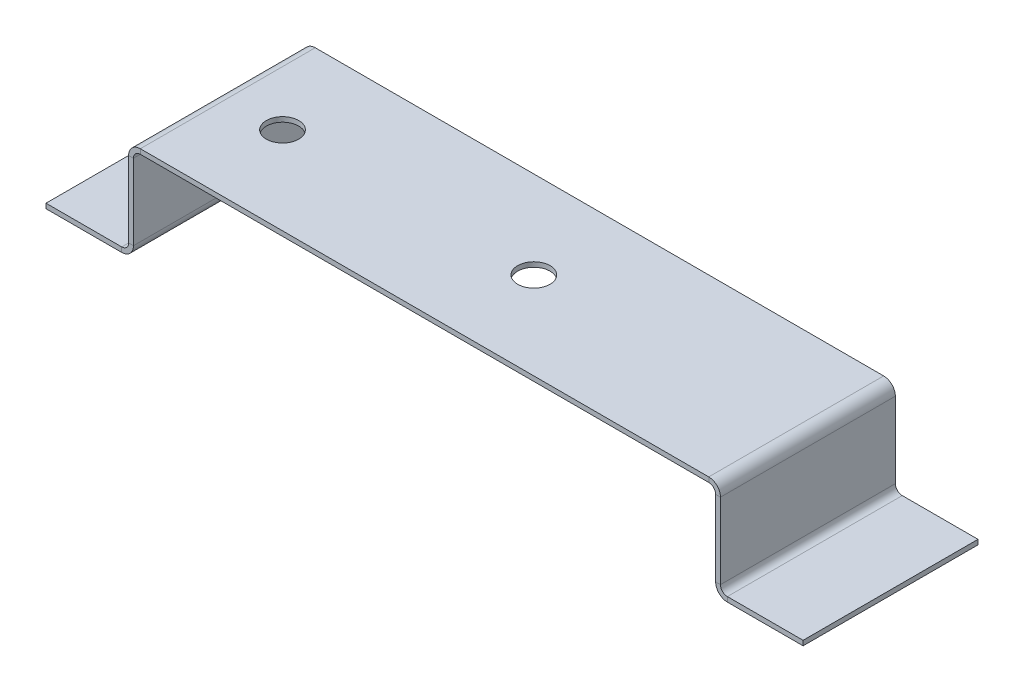
from build123d import *

# Parameters (mm, degrees)
SKETCH1_W          = 82.55
SKETCH1_H          = 25.4
BASE_FLANGE1_DEPTH = 0.7
EDGE_FLANGE1_DEPTH = 25.4
EDGE_FLANGE2_DEPTH = 25.4
EDGE_FLANGE3_DEPTH = 25.4
EDGE_FLANGE4_DEPTH = 25.4
SKETCH19_R         = 2.35
CUT_EXTRUDE1_DEPTH = 59.231440176


# Sheet-metal steps are written as plain solids
with BuildPart() as part:
    # Sketch1 → Base-Flange1 (new body)
    with BuildSketch(Plane(origin=(0, 0, 0), x_dir=(1, 0, 0), z_dir=(0, 1, 0))):
        Rectangle(SKETCH1_W, SKETCH1_H)
    extrude(amount=-BASE_FLANGE1_DEPTH)

    # Edge-Flange1 section (across the edge) → Edge-Flange1 (add)
    with BuildSketch(Plane(origin=(42.275, -0.7, -12.7), x_dir=(-1, 0, 0), z_dir=(0, 0, 1))):
        with BuildLine():
            Line((-0.7, 1), (-0.7, 12))
            Line((-0.7, 12), (0, 12))
            Line((0, 12), (0, 1))
            ThreePointArc((0, 1), (0.292893219, 0.292893219), (1, 0))
            Line((1, 0), (1, -0.7))
            ThreePointArc((1, -0.7), (-0.202081528, -0.202081528), (-0.7, 1))
        make_face()
    extrude(amount=EDGE_FLANGE1_DEPTH)

    # Edge-Flange2 section (across the edge) → Edge-Flange2 (add)
    with BuildSketch(Plane(origin=(42.975, -13.7, 12.7), x_dir=(0, 1, 0), z_dir=(0, 0, -1))):
        with BuildLine():
            Line((-0.7, 1), (-0.7, 12))
            Line((-0.7, 12), (0, 12))
            Line((0, 12), (0, 1))
            ThreePointArc((0, 1), (0.292893219, 0.292893219), (1, 0))
            Line((1, 0), (1, -0.7))
            ThreePointArc((1, -0.7), (-0.202081528, -0.202081528), (-0.7, 1))
        make_face()
    extrude(amount=EDGE_FLANGE2_DEPTH)

    # Edge-Flange3 section (across the edge) → Edge-Flange3 (add)
    with BuildSketch(Plane(origin=(-42.275, -0.7, 12.7), x_dir=(1, 0, 0), z_dir=(0, 0, -1))):
        with BuildLine():
            Line((-0.7, 1), (-0.7, 12))
            Line((-0.7, 12), (0, 12))
            Line((0, 12), (0, 1))
            ThreePointArc((0, 1), (0.292893219, 0.292893219), (1, 0))
            Line((1, 0), (1, -0.7))
            ThreePointArc((1, -0.7), (-0.202081528, -0.202081528), (-0.7, 1))
        make_face()
    extrude(amount=EDGE_FLANGE3_DEPTH)

    # Edge-Flange4 section (across the edge) → Edge-Flange4 (add)
    with BuildSketch(Plane(origin=(-42.975, -13.7, -12.7), x_dir=(0, 1, 0), z_dir=(0, 0, 1))):
        with BuildLine():
            Line((-0.7, 1), (-0.7, 12))
            Line((-0.7, 12), (0, 12))
            Line((0, 12), (0, 1))
            ThreePointArc((0, 1), (0.292893219, 0.292893219), (1, 0))
            Line((1, 0), (1, -0.7))
            ThreePointArc((1, -0.7), (-0.202081528, -0.202081528), (-0.7, 1))
        make_face()
    extrude(amount=EDGE_FLANGE4_DEPTH)

    # Sketch19 → Cut-Extrude1 (cut, through all)
    with BuildSketch(Plane(origin=(0, 0, 0), x_dir=(1, 0, 0), z_dir=(0, 1, 0))):
        with Locations(Location((-33.3248, 0, 0), (0, 0, 270))):
            Circle(SKETCH19_R)
        with Locations(Location((3.175, 0, 0), (0, 0, 270))):
            Circle(SKETCH19_R)
    extrude(amount=-CUT_EXTRUDE1_DEPTH, mode=Mode.SUBTRACT)


solid = part.part
